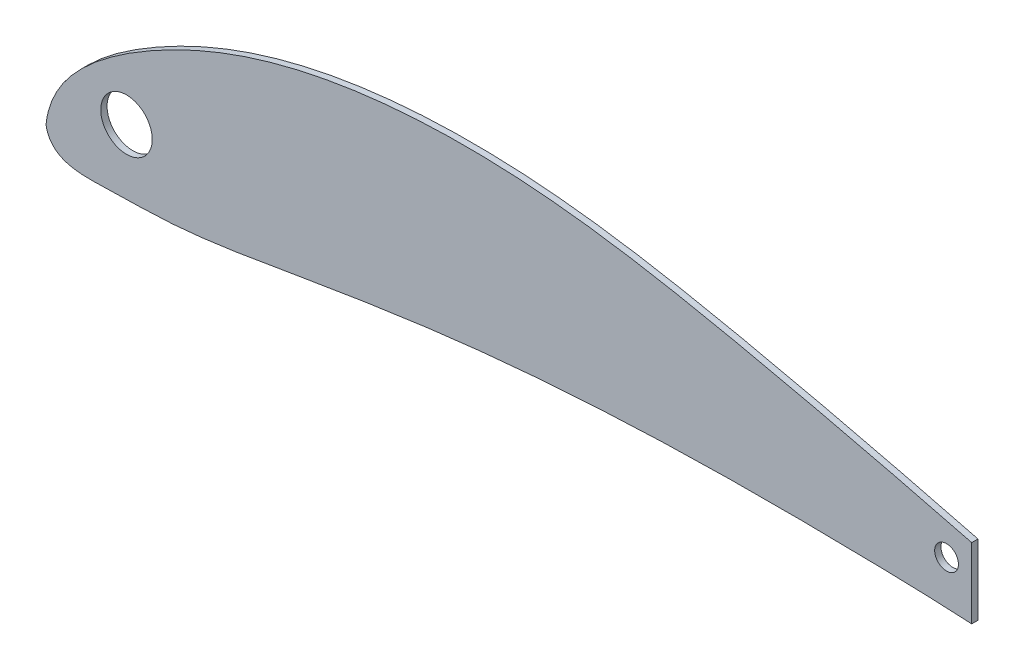
from build123d import *

# Parameters (mm, degrees)
BOSS_EXTRUDE1_DEPTH = 1.5875
SKETCH2_R           = 6.5
SKETCH2_R_2         = 3
CUT_EXTRUDE1_DEPTH  = 316.731983488
SKETCH3_W           = 116.84
SKETCH3_H           = 50.8
CUT_EXTRUDE2_DEPTH  = 316.731983488


with BuildPart() as part:
    # Sketch1 → Boss-Extrude1 (new body)
    with BuildSketch(Plane.XY):
        with BuildLine():
            add(Edge.make_bspline(
                [(0.000560351, 0.000130087), (0.810633127, 7.359196055), (8.649092025, 17.856605174), (26.286719818, 29.975176328), (52.111128271, 42.069215275), (89.597618475, 49.290763054), (131.400792109, 47.884831915), (173.256699242, 40.041104278), (217.961060472, 29.612974894), (256.952064401, 19.528920948), (290.35983767, 8.71099439), (301.273197721, 4.382828139), (314.816918223, -0.516206742), (309.846313895, 0.000130087)],
                knots=[0, 0, 0, 0, 0.060863618, 0.113688265, 0.188608742, 0.312908923, 0.448482434, 0.557612135, 0.691544113, 0.852438279, 0.92975597, 0.976058229, 1, 1, 1, 1], degree=3))
            add(Edge.make_bspline(
                [(309.846313895, 0.000130087), (303.956832565, 1.47095521), (293.989507544, 2.093987313), (276.26402299, 4.514356704), (260.846344817, 5.427413394), (235.858814759, 7.870306192), (205.101424636, 8.838080282), (157.718638092, 9.030650149), (110.497331172, 6.181495223), (66.506197185, -0.586669107), (36.454672816, -6.098499901), (15.316603331, -6.189065841), (1.230714189, -6.924076091), (0.000560351, 0.000130087)],
                knots=[0, 0, 0, 0, 0.057787081, 0.095274891, 0.171021118, 0.205339302, 0.335319146, 0.464904334, 0.658702312, 0.785511947, 0.893517288, 0.94309214, 1, 1, 1, 1], degree=3))
        make_face()
    extrude(amount=BOSS_EXTRUDE1_DEPTH)

    # Sketch2 → Cut-Extrude1 (cut, through all)
    with BuildSketch(Plane.XY.offset(1.5875)):
        with Locations((20.32, 10.16)):
            Circle(SKETCH2_R)
        with Locations((227.296313895, 19.050130087)):
            Circle(SKETCH2_R_2)
    extrude(amount=-CUT_EXTRUDE1_DEPTH, mode=Mode.SUBTRACT)

    # Sketch3 → Cut-Extrude2 (cut, through all)
    with BuildSketch(Plane.XY.offset(1.5875)):
        with Locations((292.066313895, 19.050130087)):
            Rectangle(SKETCH3_W, SKETCH3_H)
    extrude(amount=-CUT_EXTRUDE2_DEPTH, mode=Mode.SUBTRACT)


solid = part.part
